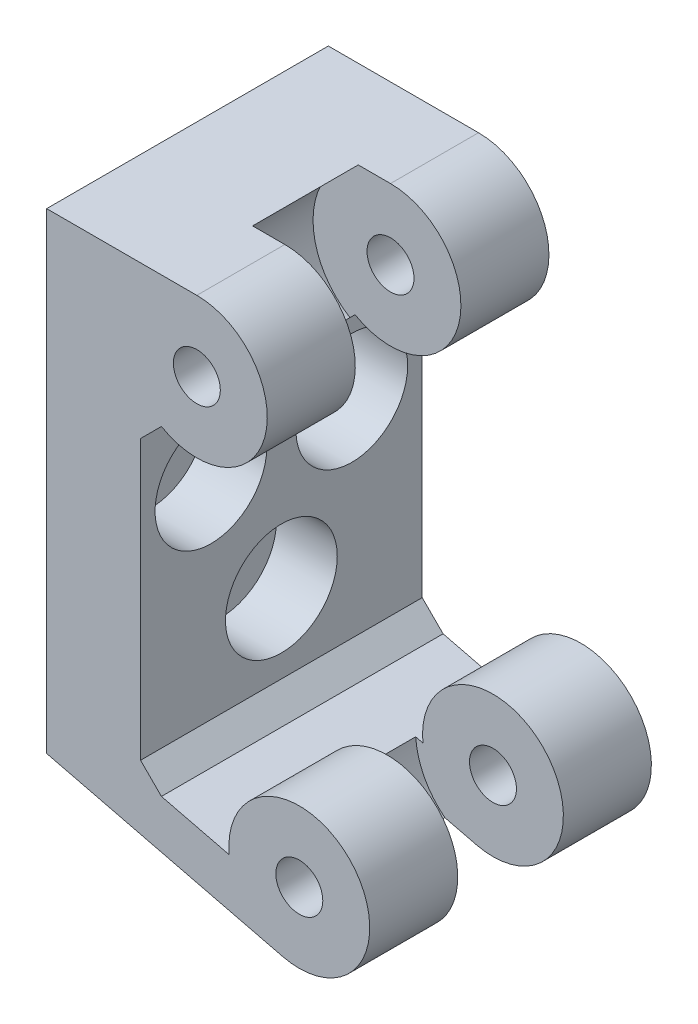
from build123d import *

# Parameters (mm, degrees)
SKETCH_OPTIMIZATION_PARAMETERS_R = 1
BOSS_EXTRUDE1_DEPTH              = 12
CUT_EXTRUDE1_DEPTH               = 2.25
CUT_EXTRUDE1_DEPTH_BACK          = 2.25
SKETCH2_R                        = 3.3
SCREW_SHAFT_HOLES_DEPTH          = 42.950678628
SCREW_SHAFT_HOLES_DEPTH_BACK     = 42.950678628
HOLE_SKETCH_R                    = 1.288405797
SKETCH5_R                        = 2.38125
SCREW_COUNTERBORES_DEPTH         = 2.591836735


with BuildPart() as part:
    # Sketch-optimization parameters → Boss-Extrude1 (new body)
    with BuildSketch(Plane.XY):
        with BuildLine():
            Line((0, 0), (0, 20.103508611))
            Line((0, 20.103508611), (6.398918491, 20.103508611))
            ThreePointArc((6.398918491, 20.103508611), (9.29529716, 16.32184973), (4.889598418, 14.510835682))
            Line((4.889598418, 14.510835682), (4, 13.621237264))
            Line((4, 13.621237264), (4, 1.750446326))
            Line((4, 1.750446326), (4.889598418, 0.860847908))
            Line((4.889598418, 0.860847908), (7.778825692, 0.152757593))
            ThreePointArc((7.778825692, 0.152757593), (13.029319293, 2.417543543), (10.049883998, -2.463020336))
            Line((10.049883998, -2.463020336), (0, 0))
        make_face()
        with Locations((6.398918491, 17.103508611)):
            Circle(SKETCH_OPTIMIZATION_PARAMETERS_R, mode=Mode.SUBTRACT)
        with Locations((10.763989156, 0.450749356)):
            Circle(SKETCH_OPTIMIZATION_PARAMETERS_R, mode=Mode.SUBTRACT)
    extrude(amount=BOSS_EXTRUDE1_DEPTH)

    # Sketch2 → Cut-Extrude1 (cut, two sides: drawn at the far end of the back side and taken through both)
    with BuildSketch(Plane.XY.offset(6).offset(-CUT_EXTRUDE1_DEPTH_BACK)):
        with Locations((6.398918491, 17.103508611)):
            Circle(SKETCH2_R)
        with Locations((10.763989156, 0.450749356)):
            Circle(SKETCH2_R)
    extrude(amount=CUT_EXTRUDE1_DEPTH + CUT_EXTRUDE1_DEPTH_BACK, mode=Mode.SUBTRACT)

    # Hole sketch → Screw shaft holes (cut, two sides: drawn at the far end of the back side and taken through both)
    with BuildSketch(Plane(origin=(4, 36.444645714, 0), x_dir=(0, 0, -1), z_dir=(-1, 0, 0)).offset(-SCREW_SHAFT_HOLES_DEPTH_BACK)):
        with Locations((-9, 25.823408449)):
            Circle(HOLE_SKETCH_R)
        with Locations((-3, 25.823408449)):
            Circle(HOLE_SKETCH_R)
        with Locations((-6, 31.355067842)):
            Circle(HOLE_SKETCH_R)
    extrude(amount=SCREW_SHAFT_HOLES_DEPTH + SCREW_SHAFT_HOLES_DEPTH_BACK, mode=Mode.SUBTRACT)

    # Sketch5 → Screw counterbores (cut)
    with BuildSketch(Plane(origin=(4, 26.197134063, 0), x_dir=(0, 0, -1), z_dir=(-1, 0, 0))):
        with Locations((-6, 21.107556192)):
            Circle(SKETCH5_R)
        with Locations((-9, 15.575896799)):
            Circle(SKETCH5_R)
        with Locations((-3, 15.575896799)):
            Circle(SKETCH5_R)
    extrude(amount=SCREW_COUNTERBORES_DEPTH, mode=Mode.SUBTRACT)


solid = part.part
